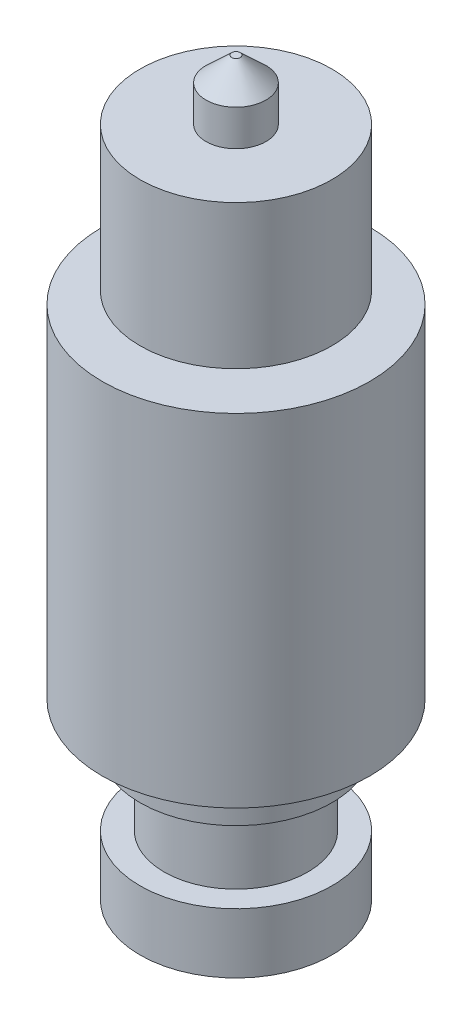
from build123d import *

# Parameters (mm, degrees)
SKETCH1_R           = 8
BOSS_EXTRUDE1_DEPTH = 5
SKETCH2_R           = 6
BOSS_EXTRUDE2_DEPTH = 6
SKETCH3_R           = 8
BOSS_EXTRUDE3_DEPTH = 1.5
SKETCH4_R           = 5
BOSS_EXTRUDE4_DEPTH = 2
SKETCH5_R           = 11.15
BOSS_EXTRUDE5_DEPTH = 28.5
SKETCH6_R           = 2
BOSS_EXTRUDE6_DEPTH = 1
SKETCH7_R           = 8
BOSS_EXTRUDE7_DEPTH = 12
SKETCH8_R           = 2.5
BOSS_EXTRUDE8_DEPTH = 3
SKETCH9_R           = 2.5
BOSS_EXTRUDE9_DEPTH = 2
BOSS_EXTRUDE9_TAPER = 47


with BuildPart() as part:
    # Sketch1 → Boss-Extrude1 (new body)
    with BuildSketch(Plane(origin=(0, 0, 0), x_dir=(1, 0, 0), z_dir=(0, 1, 0))):
        Circle(SKETCH1_R)
    extrude(amount=BOSS_EXTRUDE1_DEPTH)

    # Sketch2 → Boss-Extrude2 (add)
    with BuildSketch(Plane(origin=(0, 5, 0), x_dir=(1, 0, 0), z_dir=(0, 1, 0))):
        Circle(SKETCH2_R)
    extrude(amount=BOSS_EXTRUDE2_DEPTH)

    # Sketch3 → Boss-Extrude3 (add)
    with BuildSketch(Plane(origin=(0, 11, 0), x_dir=(1, 0, 0), z_dir=(0, 1, 0))):
        Circle(SKETCH3_R)
    extrude(amount=BOSS_EXTRUDE3_DEPTH)

    # Sketch4 → Boss-Extrude4 (add)
    with BuildSketch(Plane(origin=(0, 12.5, 0), x_dir=(1, 0, 0), z_dir=(0, 1, 0))):
        Circle(SKETCH4_R)
    extrude(amount=BOSS_EXTRUDE4_DEPTH)

    # Sketch5 → Boss-Extrude5 (add)
    with BuildSketch(Plane(origin=(0, 14.5, 0), x_dir=(1, 0, 0), z_dir=(0, 1, 0))):
        Circle(SKETCH5_R)
    extrude(amount=BOSS_EXTRUDE5_DEPTH)

    # Sketch6 → Boss-Extrude6 (add)
    with BuildSketch(Plane(origin=(0, 43, 0), x_dir=(1, 0, 0), z_dir=(0, 1, 0))):
        Circle(SKETCH6_R)
    extrude(amount=BOSS_EXTRUDE6_DEPTH)

    # Sketch7 → Boss-Extrude7 (add)
    with BuildSketch(Plane(origin=(0, 44, 0), x_dir=(1, 0, 0), z_dir=(0, 1, 0))):
        Circle(SKETCH7_R)
    extrude(amount=BOSS_EXTRUDE7_DEPTH)

    # Sketch8 → Boss-Extrude8 (add)
    with BuildSketch(Plane(origin=(0, 56, 0), x_dir=(1, 0, 0), z_dir=(0, 1, 0))):
        Circle(SKETCH8_R)
    extrude(amount=BOSS_EXTRUDE8_DEPTH)

    # Sketch9 → Boss-Extrude9 (add)
    with BuildSketch(Plane(origin=(0, 59, 0), x_dir=(1, 0, 0), z_dir=(0, 1, 0))):
        Circle(SKETCH9_R)
    extrude(amount=BOSS_EXTRUDE9_DEPTH, taper=BOSS_EXTRUDE9_TAPER)


solid = part.part
